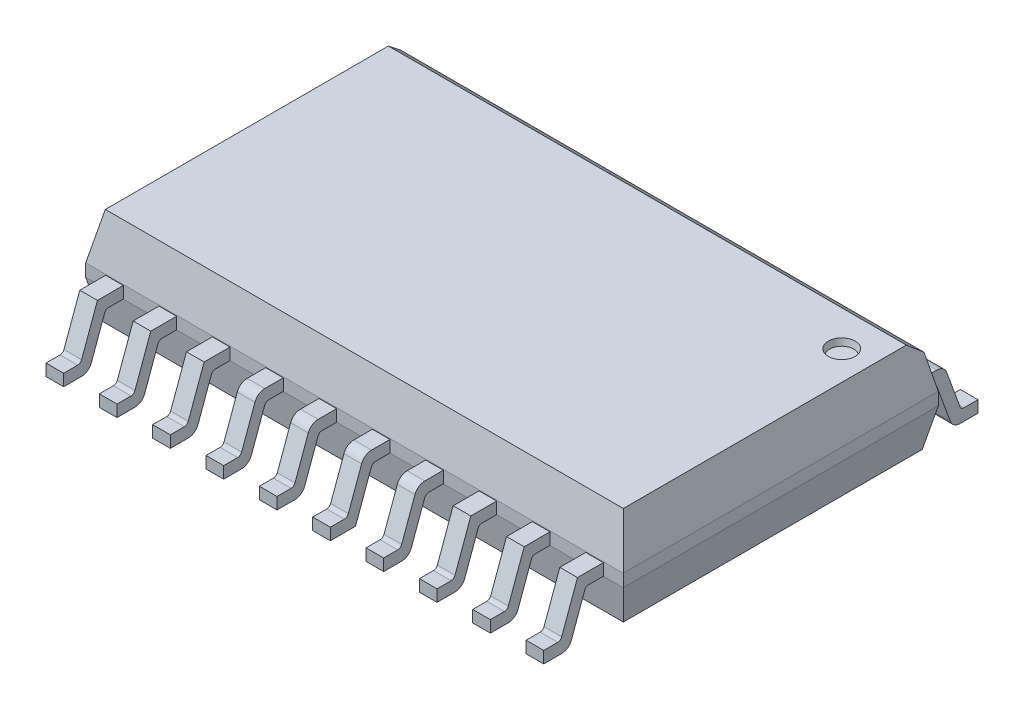
from build123d import *

# Parameters (mm, degrees)
SKETCH1_W                = 12.8
SKETCH1_H                = 7.5
EXTRUDE1_DEPTH           = 1.1
EXTRUDE1_TAPER           = 12
EXTRUDE1_OTHER_WAY_DEPTH = 0.3
SKETCH2_W                = 12.8
SKETCH2_H                = 7.5
EXTRUDE2_DEPTH           = 0.9
EXTRUDE2_TAPER           = 12
CHAMFER1_SIZE            = 0.29360287
CHAMFER1_SIZE_2          = 0.3
SKETCH3_R                = 0.317461986
CUT_EXTRUDE1_DEPTH       = 0.15
CUT_EXTRUDE1_DRAFT       = -12
EXTRUDE3_START           = 0.635
EXTRUDE3_DEPTH           = 0.21
LPATTERN3_COUNT          = 5
LPATTERN3_PITCH          = 1.27
LPATTERN3_COL_COUNT      = 6
LPATTERN3_COL_PITCH      = 1.27
FILLET1_R                = 0.1
FILLET2_R                = 0.25


with BuildPart() as part:
    # Sketch1 → Extrude1 (new body)
    with BuildSketch(Plane(origin=(0, 0, 0), x_dir=(1, 0, 0), z_dir=(0, 1, 0))):
        Rectangle(SKETCH1_W, SKETCH1_H)
    extrude(amount=EXTRUDE1_DEPTH, taper=EXTRUDE1_TAPER)

    # Sketch1 → Extrude1 other way (add)
    with BuildSketch(Plane(origin=(0, 0, 0), x_dir=(1, 0, 0), z_dir=(0, 1, 0))):
        Rectangle(SKETCH1_W, SKETCH1_H)
    extrude(amount=-EXTRUDE1_OTHER_WAY_DEPTH)

    # Sketch2 → Extrude2 (add)
    with BuildSketch(Plane.XZ.offset(0.3)):
        Rectangle(SKETCH2_W, SKETCH2_H)
    extrude(amount=EXTRUDE2_DEPTH, taper=EXTRUDE2_TAPER)

    # Chamfer1
    # the kernel refuses this chamfer: 0.3, 0.29360287 mm, written as the material it takes off along each edge
    with BuildSketch(Plane(origin=(6.939891451, 1.1, -3.516187782), x_dir=(0, 0.02519466449819602, 0.9996825640576229), z_dir=(-1, 0, 0))) as chamfer1_piece_1:
        Polygon((CHAMFER1_SIZE * 0.999682563914, -CHAMFER1_SIZE * 0.0251946644946), (-CHAMFER1_SIZE_2 * 0.232489792804, -CHAMFER1_SIZE_2 * 0.972598836233), (0, 0), align=None)
    extrude(amount=13.879782902, mode=Mode.SUBTRACT)


with BuildPart() as cut_extrude1_tool:
    # Sketch3 → Cut-Extrude1 (with draft: the straight prism first)
    with BuildSketch(Plane(origin=(0, 1.1, 0), x_dir=(-1, 0, 0), z_dir=(0, 1, 0))):
        with Locations((-5.472998964, -2.377974149)):
            Circle(SKETCH3_R)
    extrude(amount=-CUT_EXTRUDE1_DEPTH)
    # Cut-Extrude1: the draft: its side faces are tilted about the plane it starts from
    cut_extrude1_sides = [cut_extrude1_tool.faces().sort_by_distance(p)[0] for p in [
        (5.79046095, 1.025, -2.377974149),
    ]]
    draft(cut_extrude1_sides, Plane(origin=(0, 1.1, 0), x_dir=(-1, 0, 0), z_dir=(0, 1, 0)), CUT_EXTRUDE1_DRAFT)


with BuildPart() as part_1:
    add(part.part)

    # Cut-Extrude1: cut by cut_extrude1_tool
    add(cut_extrude1_tool.part, mode=Mode.SUBTRACT)

    # Sketch4 → Extrude3 (add, symmetric)
    with BuildSketch(Plane(origin=(0, 0, 0), x_dir=(0, 0, -1), z_dir=(1, 0, 0)).offset(EXTRUDE3_START)):
        Polygon((-4.766058111, -1.12), (-4.365690853, -0.02), (4.365690853, -0.02), (4.766058111, -1.12), (5.17, -1.12), (5.17, -1.4), (4.57, -1.4), (4.169632742, -0.3), (-4.169632742, -0.3), (-4.57, -1.4), (-5.17, -1.4), (-5.17, -1.12), align=None)
    extrude3 = extrude(amount=EXTRUDE3_DEPTH, both=True)

    # LPattern3: Extrude3 ×5
    with Locations(*[(i * LPATTERN3_PITCH, 0, 0) for i in range(1, LPATTERN3_COUNT)]):
        add(extrude3)

    # LPattern3 col: Extrude3 ×6
    with Locations(*[(-i * LPATTERN3_COL_PITCH, 0, 0) for i in range(1, LPATTERN3_COL_COUNT)]):
        add(extrude3)

    # Fillet1
    fillet1_edges = [part_1.edges().sort_by_distance(p)[0] for p in [
        (-0.635, -0.3, -4.169632742),
        (-1.905, -0.3, 4.169632742),
        (-1.905, -1.12, -4.766058111),
        (-1.905, -1.12, 4.766058111),
        (-1.905, -0.3, -4.169632742),
        (-3.175, -0.3, 4.169632742),
        (-3.175, -1.12, -4.766058111),
        (-3.175, -1.12, 4.766058111),
        (-3.175, -0.3, -4.169632742),
        (-4.445, -0.3, 4.169632742),
        (-4.445, -1.12, -4.766058111),
        (-4.445, -1.12, 4.766058111),
        (-4.445, -0.3, -4.169632742),
        (-5.715, -0.3, 4.169632742),
        (-5.715, -1.12, -4.766058111),
        (-5.715, -1.12, 4.766058111),
        (-5.715, -0.3, -4.169632742),
        (1.905, -0.3, 4.169632742),
        (1.905, -1.12, -4.766058111),
        (1.905, -1.12, 4.766058111),
        (1.905, -0.3, -4.169632742),
        (3.175, -0.3, 4.169632742),
        (3.175, -1.12, -4.766058111),
        (3.175, -1.12, 4.766058111),
        (3.175, -0.3, -4.169632742),
        (4.445, -0.3, 4.169632742),
        (4.445, -1.12, -4.766058111),
        (4.445, -1.12, 4.766058111),
        (4.445, -0.3, -4.169632742),
        (5.715, -0.3, 4.169632742),
        (5.715, -1.12, -4.766058111),
        (5.715, -1.12, 4.766058111),
        (5.715, -0.3, -4.169632742),
        (0.635, -0.3, 4.169632742),
        (0.635, -1.12, -4.766058111),
        (0.635, -1.12, 4.766058111),
        (0.635, -0.3, -4.169632742),
        (-0.635, -0.3, 4.169632742),
        (-0.635, -1.12, -4.766058111),
        (-0.635, -1.12, 4.766058111),
    ]]
    fillet(fillet1_edges, radius=FILLET1_R)

    # Fillet2
    fillet2_edges = [part_1.edges().sort_by_distance(p)[0] for p in [
        (-0.635, -1.4, 4.57),
        (-0.635, -1.4, -4.57),
        (-1.905, -0.02, -4.365690853),
        (-1.905, -0.02, 4.365690853),
        (-1.905, -1.4, 4.57),
        (-1.905, -1.4, -4.57),
        (-3.175, -0.02, -4.365690853),
        (-3.175, -1.4, 4.57),
        (-3.175, -1.4, -4.57),
        (-4.445, -0.02, -4.365690853),
        (-4.445, -1.4, 4.57),
        (-4.445, -1.4, -4.57),
        (-5.715, -0.02, -4.365690853),
        (-5.715, -1.4, 4.57),
        (-5.715, -1.4, -4.57),
        (1.905, -0.02, -4.365690853),
        (1.905, -0.02, 4.365690853),
        (1.905, -1.4, 4.57),
        (1.905, -1.4, -4.57),
        (3.175, -0.02, -4.365690853),
        (3.175, -1.4, 4.57),
        (3.175, -1.4, -4.57),
        (4.445, -0.02, -4.365690853),
        (4.445, -1.4, 4.57),
        (4.445, -1.4, -4.57),
        (5.715, -0.02, -4.365690853),
        (5.715, -1.4, 4.57),
        (5.715, -1.4, -4.57),
        (0.635, -0.02, -4.365690853),
        (0.635, -0.02, 4.365690853),
        (0.635, -1.4, -4.57),
        (-0.635, -0.02, -4.365690853),
        (-0.635, -0.02, 4.365690853),
    ]]
    fillet(fillet2_edges, radius=FILLET2_R)


solid = part_1.part
